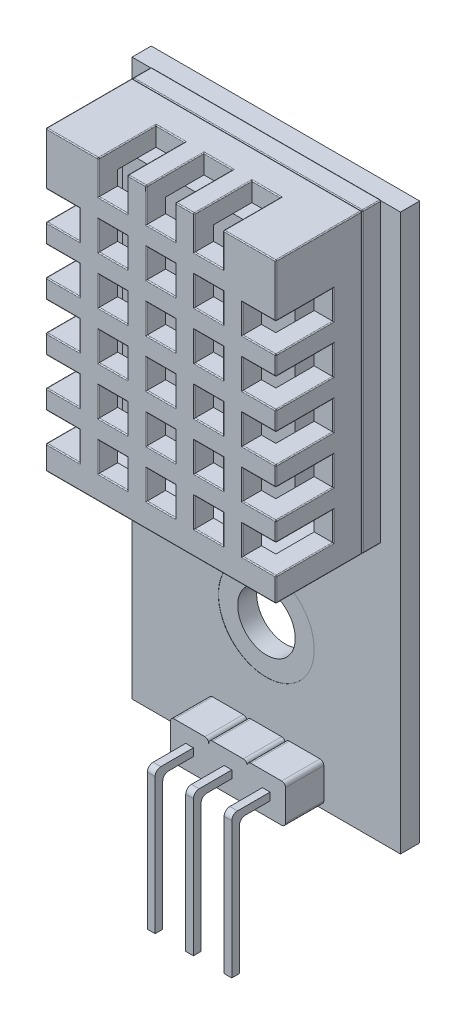
from build123d import *

# Parameters (mm, degrees)
SKETCH1_W           = 12
SKETCH1_H           = 15.5
BOSS_EXTRUDE1_DEPTH = 5.5
SHELL2_T            = -1
SKETCH3_W           = 1.5
SKETCH3_H           = 1.75
CUT_EXTRUDE1_DEPTH  = 3
SKETCH4_W           = 1.5
SKETCH4_H           = 1.5
CUT_EXTRUDE2_DEPTH  = 3
SKETCH5_W           = 1.75
SKETCH5_H           = 1.5
CUT_EXTRUDE3_DEPTH  = 3
SKETCH6_W           = 12
SKETCH6_H           = 15.5
SKETCH6_W_2         = 10
SKETCH6_H_2         = 13.5
CUT_EXTRUDE4_DEPTH  = 1
SKETCH8_W           = 12
SKETCH8_H           = 15.5
BOSS_EXTRUDE3_DEPTH = 0.99
FILLET1_R           = 0.05
FILLET2_R           = 0.05
SKETCH10_W          = 9
SKETCH10_H          = 12.5
BOSS_EXTRUDE4_DEPTH = 2
SKETCH11_W          = 14
SKETCH11_H          = 29
BOSS_EXTRUDE5_DEPTH = 1
BOSS_EXTRUDE6_DEPTH = 2
SKETCH13_W          = 0.4
SKETCH13_H          = 0.39878694
BOSS_EXTRUDE7_DEPTH = 2
SKETCH14_W          = 0.4
SKETCH14_H          = 0.400273
BOSS_EXTRUDE8_DEPTH = 7
FILLET3_R           = 0.3
FILLET4_R           = 0.3
FILLET5_R           = 0.3
FILLET6_R           = 0.3
FILLET7_R           = 0.3
FILLET8_R           = 0.3
SKETCH15_R          = 1.5
CUT_EXTRUDE5_DEPTH  = 25.112834447
SKETCH16_R          = 2.5
CUT_EXTRUDE6_DEPTH  = 0.01


with BuildPart() as part:
    # Sketch1 → Boss-Extrude1 (new body)
    with BuildSketch(Plane.XY):
        with Locations((6, 7.75)):
            Rectangle(SKETCH1_W, SKETCH1_H)
    extrude(amount=BOSS_EXTRUDE1_DEPTH)

    # Shell2
    shell2_openings = [part.faces().sort_by_distance(p)[0] for p in [
        (6, 7.75, 0),
    ]]
    offset(amount=SHELL2_T, openings=shell2_openings, kind=Kind.INTERSECTION)

    # Sketch3 → Cut-Extrude1 (cut)
    with BuildSketch(Plane.XY.offset(5.5)):
        with Locations((3.5, 14.625)):
            Rectangle(SKETCH3_W, SKETCH3_H)
        with Locations((6, 14.625)):
            Rectangle(SKETCH3_W, SKETCH3_H)
        with Locations((8.5, 14.625)):
            Rectangle(SKETCH3_W, SKETCH3_H)
    extrude(amount=-CUT_EXTRUDE1_DEPTH, mode=Mode.SUBTRACT)

    # Sketch4 → Cut-Extrude2 (cut)
    with BuildSketch(Plane.XY.offset(5.5)):
        with Locations((3.5, 12)):
            Rectangle(SKETCH4_W, SKETCH4_H)
        with Locations((6, 12)):
            Rectangle(SKETCH4_W, SKETCH4_H)
        with Locations((8.5, 12)):
            Rectangle(SKETCH4_W, SKETCH4_H)
        with Locations((6, 9.5)):
            Rectangle(SKETCH4_W, SKETCH4_H)
        with Locations((8.5, 9.5)):
            Rectangle(SKETCH4_W, SKETCH4_H)
        with Locations((6, 7)):
            Rectangle(SKETCH4_W, SKETCH4_H)
        with Locations((8.5, 7)):
            Rectangle(SKETCH4_W, SKETCH4_H)
        with Locations((6, 4.5)):
            Rectangle(SKETCH4_W, SKETCH4_H)
        with Locations((8.5, 4.5)):
            Rectangle(SKETCH4_W, SKETCH4_H)
        with Locations((6, 2)):
            Rectangle(SKETCH4_W, SKETCH4_H)
        with Locations((8.5, 2)):
            Rectangle(SKETCH4_W, SKETCH4_H)
        with Locations((3.5, 9.5)):
            Rectangle(SKETCH4_W, SKETCH4_H)
        with Locations((3.5, 7)):
            Rectangle(SKETCH4_W, SKETCH4_H)
        with Locations((3.5, 4.5)):
            Rectangle(SKETCH4_W, SKETCH4_H)
        with Locations((3.5, 2)):
            Rectangle(SKETCH4_W, SKETCH4_H)
    extrude(amount=-CUT_EXTRUDE2_DEPTH, mode=Mode.SUBTRACT)

    # Sketch5 → Cut-Extrude3 (cut)
    with BuildSketch(Plane.XY.offset(5.5)):
        with Locations((0.875, 12)):
            Rectangle(SKETCH5_W, SKETCH5_H)
        with Locations((11.125, 12)):
            Rectangle(SKETCH5_W, SKETCH5_H)
        with Locations((11.125, 9.5)):
            Rectangle(SKETCH5_W, SKETCH5_H)
        with Locations((11.125, 7)):
            Rectangle(SKETCH5_W, SKETCH5_H)
        with Locations((11.125, 4.5)):
            Rectangle(SKETCH5_W, SKETCH5_H)
        with Locations((11.125, 2)):
            Rectangle(SKETCH5_W, SKETCH5_H)
        with Locations((0.875, 9.5)):
            Rectangle(SKETCH5_W, SKETCH5_H)
        with Locations((0.875, 7)):
            Rectangle(SKETCH5_W, SKETCH5_H)
        with Locations((0.875, 4.5)):
            Rectangle(SKETCH5_W, SKETCH5_H)
        with Locations((0.875, 2)):
            Rectangle(SKETCH5_W, SKETCH5_H)
    extrude(amount=-CUT_EXTRUDE3_DEPTH, mode=Mode.SUBTRACT)

    # Sketch6 → Cut-Extrude4 (cut)
    with BuildSketch(Plane(origin=(0, 0, 0), x_dir=(-1, 0, 0), z_dir=(0, 0, -1))):
        with Locations((-6, 7.75)):
            Rectangle(SKETCH6_W, SKETCH6_H)
        with Locations((-6, 7.75)):
            Rectangle(SKETCH6_W_2, SKETCH6_H_2, mode=Mode.SUBTRACT)
    extrude(amount=-CUT_EXTRUDE4_DEPTH, mode=Mode.SUBTRACT)

    # Fillet1
    fillet1_edges = [part.edges().sort_by_distance(p)[0] for p in [
        (6, 0, 1),
        (0, 12.75, 4),
        (0, 12, 2.5),
        (0, 11.25, 4),
        (0, 10.25, 4),
        (0, 9.5, 2.5),
        (0, 8.75, 4),
        (0, 7.75, 4),
        (0, 7, 2.5),
        (0, 6.25, 4),
        (0, 5.25, 4),
        (0, 4.5, 2.5),
        (0, 3.75, 4),
        (0, 2.75, 4),
        (0, 2, 2.5),
        (0, 1.25, 4),
        (0, 0, 3.25),
        (0, 7.75, 1),
        (9.25, 15.5, 4),
        (8.5, 15.5, 2.5),
        (7.75, 15.5, 4),
        (6.75, 15.5, 4),
        (6, 15.5, 2.5),
        (5.25, 15.5, 4),
        (4.25, 15.5, 4),
        (3.5, 15.5, 2.5),
        (2.75, 15.5, 4),
        (0, 15.5, 3.25),
        (6, 15.5, 1),
        (12, 0, 3.25),
        (12, 1.25, 4),
        (12, 2, 2.5),
        (12, 2.75, 4),
        (12, 3.75, 4),
        (12, 4.5, 2.5),
        (12, 5.25, 4),
        (12, 6.25, 4),
        (12, 7, 2.5),
        (12, 7.75, 4),
        (12, 8.75, 4),
        (12, 9.5, 2.5),
        (12, 10.25, 4),
        (12, 11.25, 4),
        (12, 12, 2.5),
        (12, 12.75, 4),
        (12, 15.5, 3.25),
        (12, 7.75, 1),
        (0.875, 3.75, 5.5),
        (1.75, 4.5, 5.5),
        (0.875, 5.25, 5.5),
        (0, 5.75, 5.5),
        (0.875, 6.25, 5.5),
        (1.75, 7, 5.5),
        (0.875, 7.75, 5.5),
        (0, 8.25, 5.5),
        (0.875, 8.75, 5.5),
        (1.75, 9.5, 5.5),
        (0.875, 10.25, 5.5),
        (0, 10.75, 5.5),
        (0.875, 11.25, 5.5),
        (1.75, 12, 5.5),
        (0.875, 12.75, 5.5),
        (0, 14.125, 5.5),
        (1.375, 15.5, 5.5),
        (2.75, 14.625, 5.5),
        (3.5, 13.75, 5.5),
        (4.25, 14.625, 5.5),
        (4.75, 15.5, 5.5),
        (5.25, 14.625, 5.5),
        (6, 13.75, 5.5),
        (6.75, 14.625, 5.5),
        (7.25, 15.5, 5.5),
        (7.75, 14.625, 5.5),
        (8.5, 13.75, 5.5),
        (9.25, 14.625, 5.5),
        (10.625, 15.5, 5.5),
        (12, 14.125, 5.5),
        (11.125, 12.75, 5.5),
        (10.25, 12, 5.5),
        (11.125, 11.25, 5.5),
        (12, 10.75, 5.5),
        (11.125, 10.25, 5.5),
        (10.25, 9.5, 5.5),
        (11.125, 8.75, 5.5),
        (12, 8.25, 5.5),
        (11.125, 7.75, 5.5),
        (10.25, 7, 5.5),
        (11.125, 6.25, 5.5),
        (12, 5.75, 5.5),
        (11.125, 5.25, 5.5),
        (10.25, 4.5, 5.5),
        (11.125, 3.75, 5.5),
        (12, 3.25, 5.5),
        (11.125, 2.75, 5.5),
        (10.25, 2, 5.5),
        (11.125, 1.25, 5.5),
        (12, 0.625, 5.5),
        (6, 0, 5.5),
        (0, 0.625, 5.5),
        (0.875, 1.25, 5.5),
        (1.75, 2, 5.5),
        (0.875, 2.75, 5.5),
        (0, 3.25, 5.5),
        (4.25, 12, 5.5),
        (3.5, 12.75, 5.5),
        (2.75, 12, 5.5),
        (3.5, 11.25, 5.5),
        (6.75, 12, 5.5),
        (6, 12.75, 5.5),
        (5.25, 12, 5.5),
        (6, 11.25, 5.5),
        (9.25, 12, 5.5),
        (8.5, 12.75, 5.5),
        (7.75, 12, 5.5),
        (8.5, 11.25, 5.5),
        (6.75, 9.5, 5.5),
        (6, 10.25, 5.5),
        (5.25, 9.5, 5.5),
        (6, 8.75, 5.5),
        (9.25, 9.5, 5.5),
        (8.5, 10.25, 5.5),
        (7.75, 9.5, 5.5),
        (8.5, 8.75, 5.5),
        (6.75, 7, 5.5),
        (6, 7.75, 5.5),
        (5.25, 7, 5.5),
        (6, 6.25, 5.5),
        (9.25, 7, 5.5),
        (8.5, 7.75, 5.5),
        (7.75, 7, 5.5),
        (8.5, 6.25, 5.5),
        (6.75, 4.5, 5.5),
        (6, 5.25, 5.5),
        (5.25, 4.5, 5.5),
        (6, 3.75, 5.5),
        (9.25, 4.5, 5.5),
        (8.5, 5.25, 5.5),
        (7.75, 4.5, 5.5),
        (8.5, 3.75, 5.5),
        (6.75, 2, 5.5),
        (6, 2.75, 5.5),
        (5.25, 2, 5.5),
        (6, 1.25, 5.5),
        (9.25, 2, 5.5),
        (8.5, 2.75, 5.5),
        (7.75, 2, 5.5),
        (8.5, 1.25, 5.5),
        (4.25, 9.5, 5.5),
        (3.5, 10.25, 5.5),
        (2.75, 9.5, 5.5),
        (3.5, 8.75, 5.5),
        (4.25, 7, 5.5),
        (3.5, 7.75, 5.5),
        (2.75, 7, 5.5),
        (3.5, 6.25, 5.5),
        (4.25, 4.5, 5.5),
        (3.5, 5.25, 5.5),
        (2.75, 4.5, 5.5),
        (3.5, 3.75, 5.5),
        (4.25, 2, 5.5),
        (3.5, 2.75, 5.5),
        (2.75, 2, 5.5),
        (3.5, 1.25, 5.5),
    ]]
    fillet(fillet1_edges, radius=FILLET1_R)


with BuildPart() as body_2:
    # Sketch8 → Boss-Extrude3 (new body)
    with BuildSketch(Plane.XY.offset(0.99)):
        with Locations((6, 7.75)):
            Rectangle(SKETCH8_W, SKETCH8_H)
    extrude(amount=-BOSS_EXTRUDE3_DEPTH)

    # Fillet2
    fillet2_edges = [body_2.edges().sort_by_distance(p)[0] for p in [
        (6, 15.5, 0.99),
        (0, 15.5, 0.495),
        (0, 7.75, 0.99),
        (0, 0, 0.495),
        (6, 0, 0.99),
        (12, 15.5, 0.495),
        (12, 0, 0.495),
        (12, 7.75, 0.99),
        (6, 15.5, 0),
        (0, 7.75, 0),
        (6, 0, 0),
        (12, 7.75, 0),
    ]]
    fillet(fillet2_edges, radius=FILLET2_R)

    # Sketch10 → Boss-Extrude4 (add)
    with BuildSketch(Plane.XY.offset(0.99)):
        with Locations((6, 7.75)):
            Rectangle(SKETCH10_W, SKETCH10_H)
    extrude(amount=BOSS_EXTRUDE4_DEPTH)

    # Sketch11 → Boss-Extrude5 (add)
    with BuildSketch(Plane(origin=(0, 0, 0), x_dir=(-1, 0, 0), z_dir=(0, 0, -1))):
        with Locations((-6, 0.95)):
            Rectangle(SKETCH11_W, SKETCH11_H)
    extrude(amount=BOSS_EXTRUDE5_DEPTH)

    # Sketch12 → Boss-Extrude6 (add)
    with BuildSketch(Plane.XY):
        with BuildLine():
            ThreePointArc((3.2, -11.35), (3.058578644, -11.408578644), (3, -11.55))
            Line((3, -11.55), (3, -13.15))
            ThreePointArc((3, -13.15), (3.058578644, -13.291421356), (3.2, -13.35))
            Line((3.2, -13.35), (4.8, -13.35))
            ThreePointArc((4.8, -13.35), (4.941421356, -13.291421356), (5, -13.15))
            ThreePointArc((5, -13.15), (5.058578644, -13.291421356), (5.2, -13.35))
            Line((5.2, -13.35), (6.8, -13.35))
            ThreePointArc((6.8, -13.35), (6.941421356, -13.291421356), (7, -13.15))
            ThreePointArc((7, -13.15), (7.058578644, -13.291421356), (7.2, -13.35))
            Line((7.2, -13.35), (8.8, -13.35))
            ThreePointArc((8.8, -13.35), (8.941421356, -13.291421356), (9, -13.15))
            Line((9, -13.15), (9, -11.55))
            ThreePointArc((9, -11.55), (8.941421356, -11.408578644), (8.8, -11.35))
            Line((8.8, -11.35), (7.2, -11.35))
            ThreePointArc((7.2, -11.35), (7.058578644, -11.408578644), (7, -11.55))
            ThreePointArc((7, -11.55), (6.941421356, -11.408578644), (6.8, -11.35))
            Line((6.8, -11.35), (5.2, -11.35))
            ThreePointArc((5.2, -11.35), (5.058578644, -11.408578644), (5, -11.55))
            ThreePointArc((5, -11.55), (4.941421356, -11.408578644), (4.8, -11.35))
            Line((4.8, -11.35), (3.2, -11.35))
        make_face()
    extrude(amount=BOSS_EXTRUDE6_DEPTH)

    # Sketch13 → Boss-Extrude7 (add)
    with BuildSketch(Plane.XY.offset(2)):
        with Locations((4, -12.35)):
            Rectangle(SKETCH13_W, SKETCH13_H)
        with Locations((6, -12.35)):
            Rectangle(SKETCH13_W, SKETCH13_H)
        with Locations((8, -12.35)):
            Rectangle(SKETCH13_W, SKETCH13_H)
    extrude(amount=BOSS_EXTRUDE7_DEPTH)

    # Sketch14 → Boss-Extrude8 (add)
    with BuildSketch(Plane.XZ.offset(12.54939347)):
        with Locations((6, 3.7998635)):
            Rectangle(SKETCH14_W, SKETCH14_H)
        with Locations((4, 3.7998635)):
            Rectangle(SKETCH14_W, SKETCH14_H)
        with Locations((8, 3.7998635)):
            Rectangle(SKETCH14_W, SKETCH14_H)
    extrude(amount=BOSS_EXTRUDE8_DEPTH)

    # Fillet3
    fillet3_edges = [body_2.edges().sort_by_distance(p)[0] for p in [
        (4, -12.54939347, 3.599727),
    ]]
    fillet(fillet3_edges, radius=FILLET3_R)

    # Fillet4
    fillet4_edges = [body_2.edges().sort_by_distance(p)[0] for p in [
        (6, -12.54939347, 3.599727),
    ]]
    fillet(fillet4_edges, radius=FILLET4_R)

    # Fillet5
    fillet5_edges = [body_2.edges().sort_by_distance(p)[0] for p in [
        (8, -12.54939347, 3.599727),
    ]]
    fillet(fillet5_edges, radius=FILLET5_R)

    # Fillet6
    fillet6_edges = [body_2.edges().sort_by_distance(p)[0] for p in [
        (4, -12.15060653, 4),
    ]]
    fillet(fillet6_edges, radius=FILLET6_R)

    # Fillet7
    fillet7_edges = [body_2.edges().sort_by_distance(p)[0] for p in [
        (6, -12.15060653, 4),
    ]]
    fillet(fillet7_edges, radius=FILLET7_R)

    # Fillet8
    fillet8_edges = [body_2.edges().sort_by_distance(p)[0] for p in [
        (8, -12.15060653, 4),
    ]]
    fillet(fillet8_edges, radius=FILLET8_R)

    # Sketch15 → Cut-Extrude5 (cut, through all)
    with BuildSketch(Plane.XY):
        with Locations((6, -6.566844141)):
            Circle(SKETCH15_R)
    extrude(amount=-CUT_EXTRUDE5_DEPTH, mode=Mode.SUBTRACT)

    # Sketch16 → Cut-Extrude6 (cut)
    with BuildSketch(Plane.XY):
        with Locations((6, -6.566844141)):
            Circle(SKETCH16_R)
    extrude(amount=-CUT_EXTRUDE6_DEPTH, mode=Mode.SUBTRACT)


solid = Compound([part.part, body_2.part])
